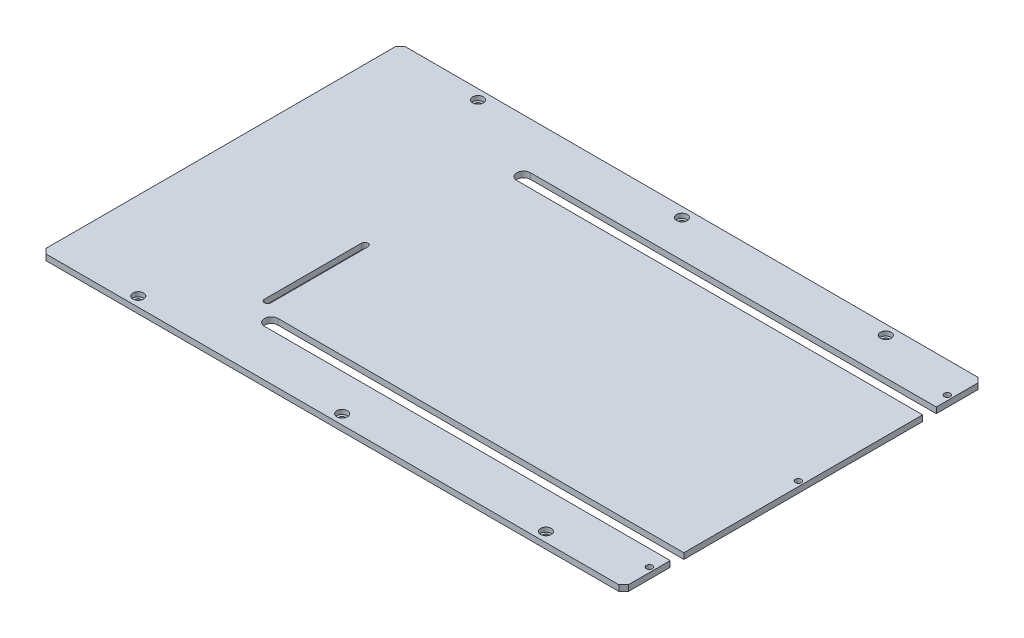
from build123d import *

# Parameters (mm, degrees)
SKETCH_1_W          = 300
SKETCH_1_H          = 185
EXTRUDE_1_DEPTH     = 3
CUT_EXTRUDE_1_DEPTH = 10
SKETCH_3_R          = 1.65
CUT_EXTRUDE_2_DEPTH = 10
SKETCH_4_W          = 209
SKETCH_4_H          = 7
CUT_EXTRUDE_3_DEPTH = 10
SKETCH_5_R          = 3.5
CUT_EXTRUDE_5_DEPTH = 10
SKETCH_6_R          = 1.55
CUT_EXTRUDE_6_DEPTH = 10
SKETCH_7_R          = 1.55
CUT_EXTRUDE_8_DEPTH = 10
SKETCH_8_R          = 2.75
CUT_EXTRUDE_9_DEPTH = 2.3
CHAMFER_1_SIZE      = 2.5


with BuildPart() as part:
    # 스케치1 → 보스-돌출1 (new body)
    with BuildSketch(Plane(origin=(0, 0, 0), x_dir=(1, 0, 0), z_dir=(0, 1, 0))):
        with Locations((150, 92.5)):
            Rectangle(SKETCH_1_W, SKETCH_1_H)
    extrude(amount=EXTRUDE_1_DEPTH)

    # 스케치2 → 컷-돌출1 (cut)
    with BuildSketch(Plane(origin=(0, 3, 0), x_dir=(1, 0, 0), z_dir=(0, 1, 0))):
        Polygon((78.9, 61.106579113), (78.9, 86.106579113), (82.2, 86.106579113), (82.2, 36.106579113), (78.9, 36.106579113), align=None)
    extrude(amount=-CUT_EXTRUDE_1_DEPTH, mode=Mode.SUBTRACT)

    # 스케치3 → 컷-돌출2 (cut)
    with BuildSketch(Plane(origin=(0, 3, 0), x_dir=(1, 0, 0), z_dir=(0, 1, 0))):
        with Locations((80.55, 86.106579113)):
            Circle(SKETCH_3_R)
        with Locations((80.55, 36.106579113)):
            Circle(SKETCH_3_R)
    extrude(amount=-CUT_EXTRUDE_2_DEPTH, mode=Mode.SUBTRACT)

    # 스케치4 → 컷-돌출3 (cut)
    with BuildSketch(Plane(origin=(0, 3, 0), x_dir=(1, 0, 0), z_dir=(0, 1, 0))):
        with Locations((195.5, 157.5)):
            Rectangle(SKETCH_4_W, SKETCH_4_H)
        with Locations((195.5, 27.5)):
            Rectangle(SKETCH_4_W, SKETCH_4_H)
    extrude(amount=-CUT_EXTRUDE_3_DEPTH, mode=Mode.SUBTRACT)

    # 스케치5 → 컷-돌출5 (cut)
    with BuildSketch(Plane(origin=(0, 3, 0), x_dir=(1, 0, 0), z_dir=(0, 1, 0))):
        with Locations((91, 157.5)):
            Circle(SKETCH_5_R)
        with Locations((91, 27.5)):
            Circle(SKETCH_5_R)
    extrude(amount=-CUT_EXTRUDE_5_DEPTH, mode=Mode.SUBTRACT)

    # 스케치6 → 컷-돌출6 (cut)
    with BuildSketch(Plane.XZ):
        with Locations((297.5, -169.2)):
            Circle(SKETCH_6_R)
        with Locations((297.5, -92.5)):
            Circle(SKETCH_6_R)
        with Locations((297.5, -15.75)):
            Circle(SKETCH_6_R)
    extrude(amount=-CUT_EXTRUDE_6_DEPTH, mode=Mode.SUBTRACT)

    # 스케치7 → 컷-돌출8 (cut)
    with BuildSketch(Plane(origin=(0, 0, 0), x_dir=(-1, 0, 0), z_dir=(0, -1, 0))):
        with Locations((-255, 180)):
            Circle(SKETCH_7_R)
        with Locations((-150, 180)):
            Circle(SKETCH_7_R)
        with Locations((-45, 180)):
            Circle(SKETCH_7_R)
        with Locations((-45, 5)):
            Circle(SKETCH_7_R)
        with Locations((-150, 5)):
            Circle(SKETCH_7_R)
        with Locations((-255, 5)):
            Circle(SKETCH_7_R)
    extrude(amount=-CUT_EXTRUDE_8_DEPTH, mode=Mode.SUBTRACT)

    # 스케치8 → 컷-돌출9 (cut)
    with BuildSketch(Plane(origin=(0, 3, 0), x_dir=(1, 0, 0), z_dir=(0, 1, 0))):
        with Locations((45, 5)):
            Circle(SKETCH_8_R)
        with Locations((150, 5)):
            Circle(SKETCH_8_R)
        with Locations((255, 5)):
            Circle(SKETCH_8_R)
        with Locations((255, 180)):
            Circle(SKETCH_8_R)
        with Locations((150, 180)):
            Circle(SKETCH_8_R)
        with Locations((45, 180)):
            Circle(SKETCH_8_R)
    extrude(amount=-CUT_EXTRUDE_9_DEPTH, mode=Mode.SUBTRACT)

    # 모따기1
    chamfer_1_edges = [part.edges().sort_by_distance(p)[0] for p in [
        (0, 1.5, 0),
        (0, 1.5, -185),
        (300, 1.5, 0),
        (300, 1.5, -185),
    ]]
    chamfer(chamfer_1_edges, length=CHAMFER_1_SIZE)


solid = part.part
